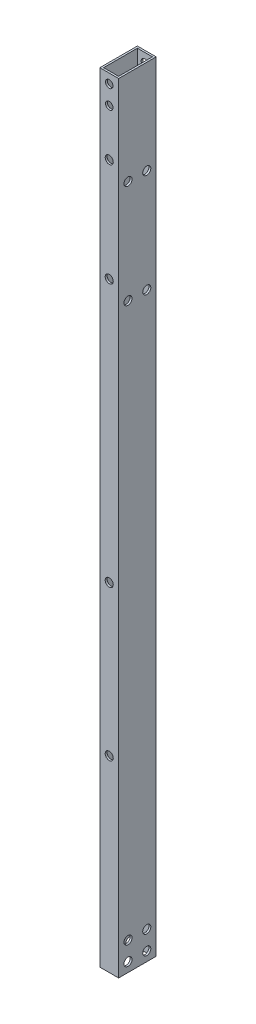
from build123d import *

# Parameters (mm, degrees)
SKETCH_1_W          = 10
SKETCH_1_H          = 20
SKETCH_1_W_2        = 8
SKETCH_1_H_2        = 18
EXTRUDE_1_DEPTH     = 415
SKETCH_2_R          = 2.15
CUT_EXTRUDE_1_DEPTH = 416.24089394
SKETCH_3_R          = 2.15
SKETCH_3_R_2        = 2
CUT_EXTRUDE_2_DEPTH = 416.511732686


with BuildPart() as part:
    # ｽｹｯﾁ1 → 押し出し-薄板1 (new body)
    with BuildSketch(Plane(origin=(0, 0, 0), x_dir=(1, 0, 0), z_dir=(0, 1, 0))):
        Rectangle(SKETCH_1_W, SKETCH_1_H)
        Rectangle(SKETCH_1_W_2, SKETCH_1_H_2, mode=Mode.SUBTRACT)
    extrude(amount=EXTRUDE_1_DEPTH)

    # ｽｹｯﾁ2 → ｶｯﾄ - 押し出し1 (cut, through all)
    with BuildSketch(Plane(origin=(5, 0, 0), x_dir=(0, 0, -1), z_dir=(1, 0, 0))):
        with Locations((5, 310)):
            Circle(SKETCH_2_R)
        with Locations((5, 365)):
            Circle(SKETCH_2_R)
        with Locations((5, 5)):
            Circle(SKETCH_2_R)
        with Locations((5, 15)):
            Circle(SKETCH_2_R)
        with Locations((-5, 365)):
            Circle(SKETCH_2_R)
        with Locations((-5, 310)):
            Circle(SKETCH_2_R)
        with Locations((-5, 15)):
            Circle(SKETCH_2_R)
        with Locations((-5, 5)):
            Circle(SKETCH_2_R)
    extrude(amount=-CUT_EXTRUDE_1_DEPTH, mode=Mode.SUBTRACT)

    # ｽｹｯﾁ3 → ｶｯﾄ - 押し出し2 (cut, through all)
    with BuildSketch(Plane.XY.offset(10)):
        with Locations((0, 320)):
            Circle(SKETCH_3_R)
        with Locations((0, 375)):
            Circle(SKETCH_3_R)
        with Locations((0, 180)):
            Circle(SKETCH_3_R)
        with Locations((0, 100)):
            Circle(SKETCH_3_R)
        with Locations((0, 410)):
            Circle(SKETCH_3_R_2)
        with Locations((0, 400)):
            Circle(SKETCH_3_R_2)
    extrude(amount=-CUT_EXTRUDE_2_DEPTH, mode=Mode.SUBTRACT)


solid = part.part
